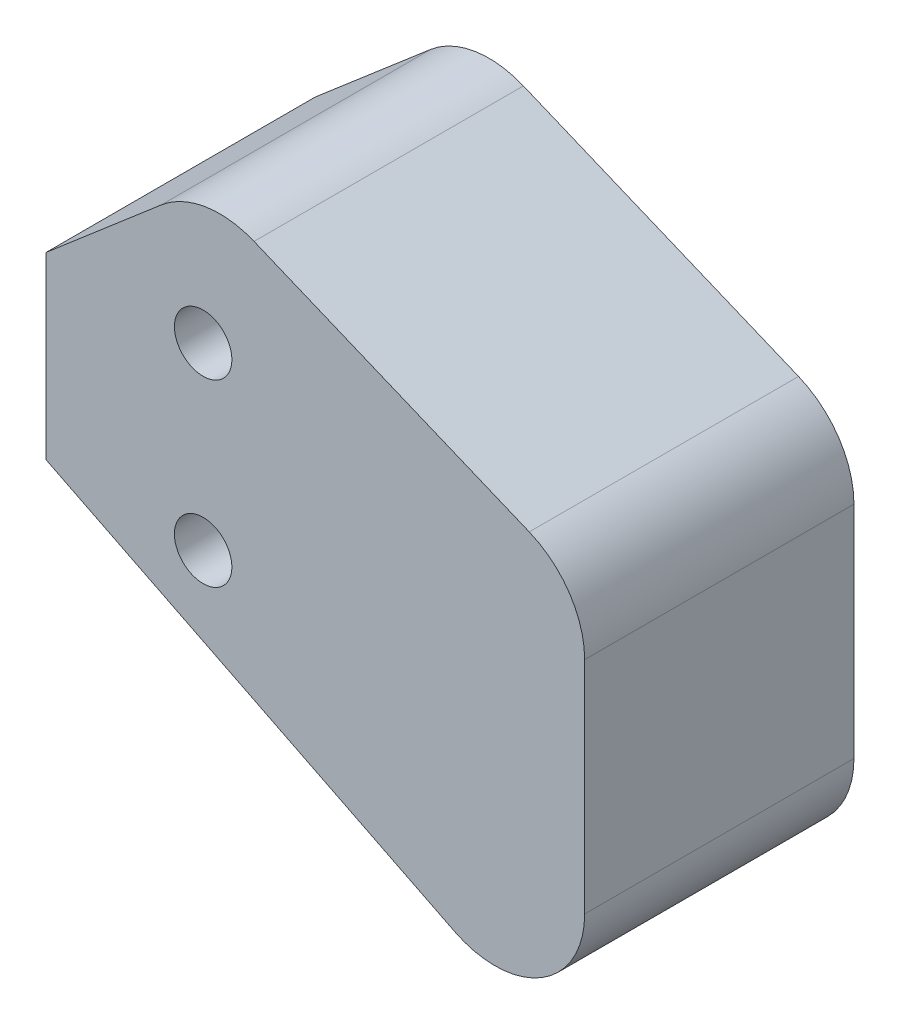
from build123d import *

# Parameters (mm, degrees)
SKETCH1_R           = 2.032
BOSS_EXTRUDE1_DEPTH = 19.05
FILLET1_R           = 6.35


with BuildPart() as part:
    # Sketch1 → Boss-Extrude1 (new body)
    with BuildSketch(Plane.XY):
        Polygon((0, 0), (0, 12.7), (11.1125, 22.225), (38.1, 11.046411485), (38.1, -19.05), align=None)
        with Locations((11.1125, 12.7)):
            Circle(SKETCH1_R, mode=Mode.SUBTRACT)
        with Locations((11.1125, 0)):
            Circle(SKETCH1_R, mode=Mode.SUBTRACT)
    extrude(amount=BOSS_EXTRUDE1_DEPTH)

    # Fillet1
    fillet1_edges = [part.edges().sort_by_distance(p)[0] for p in [
        (38.1, 11.046411485, 9.525),
        (11.1125, 22.225, 9.525),
        (38.1, -19.05, 9.525),
    ]]
    fillet(fillet1_edges, radius=FILLET1_R)


solid = part.part
